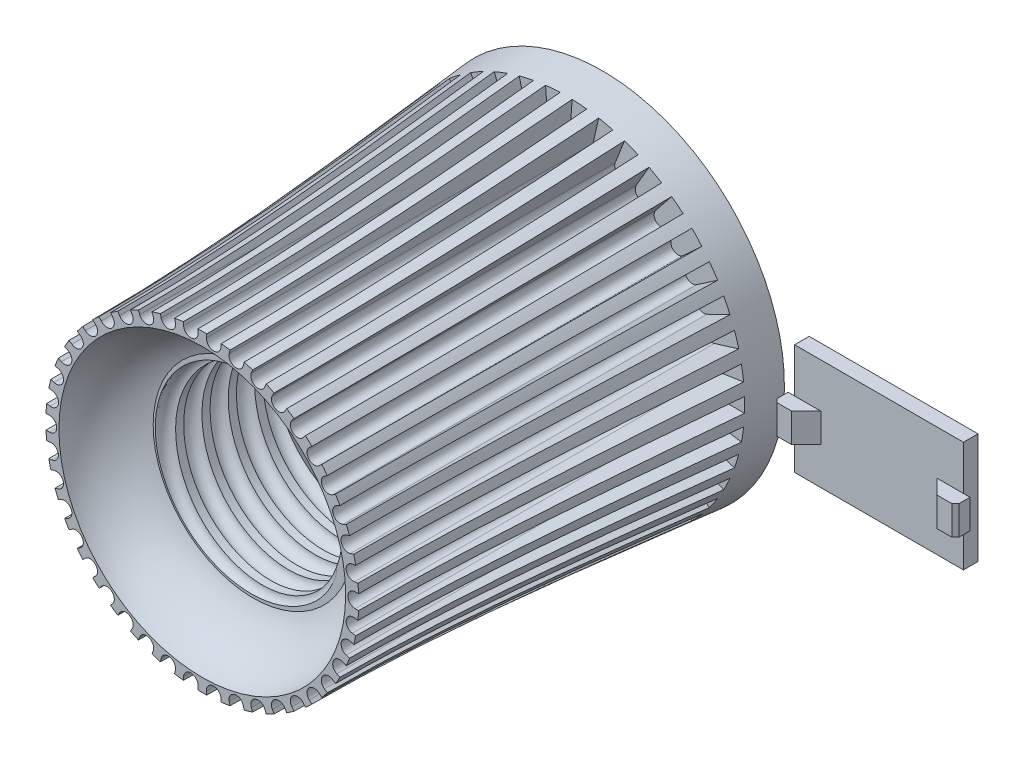
from build123d import *
from build123d.topology import SkipClean

# Parameters (mm, degrees)
CUT_SWEEP1_PITCH         = 3.62
CUT_EXTRUDE1_DEPTH       = 50
SKETCH5_W                = 6
SKETCH5_H                = 12
CUT_EXTRUDE2_DEPTH       = 1
CUT_EXTRUDE3_DEPTH       = 4
SKETCH10_R               = 1.7
CUT_EXTRUDE4_DEPTH       = 10
SKETCH11_W               = 24
SKETCH11_H               = 16
CUT_EXTRUDE5_DEPTH       = 13
SKETCH12_R               = 3
CUT_EXTRUDE6_DEPTH       = 69.840395282
SKETCH13_W               = 2
SKETCH13_H               = 4
CUT_EXTRUDE7_DEPTH       = 1.5
CHAMFER1_SIZE            = 1.5
CHAMFER1_OF_MIRROR1_SIZE = 1.5
SKETCH14_W               = 23.2
SKETCH14_H               = 15.2
EXTRUDE2_DEPTH           = 2
EXTRUDE3_START           = -3.5
EXTRUDE3_DEPTH           = 4
CIRPATTERN1_COUNT        = 42
CUT_EXTRUDE9_START       = -1.5
CUT_EXTRUDE9_DEPTH       = 5
CUT_EXTRUDE10_DEPTH      = 1.5
SKETCH18_W               = 0.9
SKETCH18_H               = 5.399427982
EXTRUDE4_DEPTH           = 7


with BuildPart() as part:
    # Sketch2 → Revolve1 (revolve)
    with BuildSketch(Plane(origin=(0, 0, 0), x_dir=(0, 0, -1), z_dir=(1, 0, 0)), mode=Mode.PRIVATE) as revolve1_sk:
        with BuildLine():
            Line((-48, 12.25), (-33, 12.25))
            Line((-33, 12.25), (-28, 17.25))
            Line((-28, 17.25), (-19, 17.25))
            Line((-19, 17.25), (-19, 3))
            Line((-19, 3), (-18, 3))
            Line((-18, 3), (-18, 1.7))
            Line((-18, 1.7), (-8, 1.7))
            Line((-8, 1.7), (-8, 0))
            Line((-8, 0), (0, 0))
            Line((0, 0), (0, 25))
            add(Edge.make_bspline(
                [(-55, 21.5), (-37.361374455, 21.5), (-18.680687228, 23.25), (0, 25)],
                knots=[0, 0, 0, 0, 1, 1, 1, 1], degree=3))
            Line((-55, 21.5), (-55, 19.7))
            add(Edge.make_bspline(
                [(-55, 19.7), (-51.79205236, 19.20456973), (-48.943366723, 16.663436936), (-48, 13.75)],
                knots=[0, 0, 0, 0, 1, 1, 1, 1], degree=3))
            Line((-48, 13.75), (-48, 12.25))
        make_face()
    revolve(revolve1_sk.sketch.rotate(Axis((0, 0, 0), (0, 0, 1)), 90), axis=Axis((0, 0, 0), (0, 0, 1)))

    # Cut-Sweep1: arcs per turn and ends read off the stored shape
    # Cut-Sweep1: the profile of Sketch7 screwed along a right-hand helix through 6 turns, 6 arcs to a turn; built about Z, then put on its axis
    cut_sweep1_z = Axis((0, 0, 0), (0, 0, 1))
    cut_sweep1_corners = [(12.25, 3.4208e-05, -2.714998391), (2.25, 6.283e-06, -2.714998391), (2.25, 6.283e-06, -0.214998391), (12.25, 3.4208e-05, -0.214998391), (13.5, 3.7699e-05, -1.464998391)]
    with BuildLine(mode=Mode.PRIVATE) as cut_sweep1_profile:
        Line(cut_sweep1_corners[0], cut_sweep1_corners[1])
        Line(cut_sweep1_corners[1], cut_sweep1_corners[2])
        Line(cut_sweep1_corners[2], cut_sweep1_corners[3])
        ThreePointArc((12.25, 3.4208e-05, -0.214998391), (13.133883476, 3.6677e-05, -0.581114915), (13.5, 3.7699e-05, -1.464998391))
        ThreePointArc((13.5, 3.7699e-05, -1.464998391), (13.133883476, 3.6677e-05, -2.348881868), (12.25, 3.4208e-05, -2.714998391))
    cut_sweep1_cap = Face(cut_sweep1_profile.wire())
    cut_sweep1_arcs = [((12.25, 3.4208e-05, -0.214998391), (13.5, 3.7699e-05, -0.214998391), (13.5, 3.7699e-05, -1.464998391), (1, 0.707106781186544, 1)), ((13.5, 3.7699e-05, -1.464998391), (13.5, 3.7699e-05, -2.714998391), (12.25, 3.4208e-05, -2.714998391), (1, 0.707106781186544, 1))]  # start, shoulder, end, weights
    cut_sweep1_turn_angles = [0, 30, 60, 90, 120, 150, 180, 210, 240, 270, 300, 330, 360]
    cut_sweep1_turn_weights = [1, 0.8660254037844387, 1, 0.8660254037844387, 1, 0.8660254037844387, 1, 0.8660254037844387, 1, 0.8660254037844387, 1, 0.8660254037844387, 1]
    cut_sweep1_turn_rails = [Edge.make_bspline([Vector(p[0], p[1], 0).rotate(cut_sweep1_z, cut_sweep1_turn_angles[k]) / cut_sweep1_turn_weights[k] + Vector(0, 0, p[2] + CUT_SWEEP1_PITCH * cut_sweep1_turn_angles[k] / 360) for k in range(13)], [0, 0, 0, 1, 1, 2, 2, 3, 3, 4, 4, 5, 5, 6, 6, 6], 2, cut_sweep1_turn_weights) for p in cut_sweep1_corners]
    cut_sweep1_turn_sides = [*[Face.make_surface_from_curves(cut_sweep1_turn_rails[p[0]], cut_sweep1_turn_rails[p[1]]) for p in [(0, 1), (1, 2), (2, 3)]], *[Face.make_bezier_surface([[Vector(p[j][0], p[j][1], 0).rotate(cut_sweep1_z, cut_sweep1_turn_angles[2 * i + k]) / cut_sweep1_turn_weights[2 * i + k] + Vector(0, 0, p[j][2] + CUT_SWEEP1_PITCH * cut_sweep1_turn_angles[2 * i + k] / 360) for k in range(3)] for j in range(3)], [[p[3][j] * cut_sweep1_turn_weights[2 * i + k] for k in range(3)] for j in range(3)]) for p in cut_sweep1_arcs for i in range(6)]]
    cut_sweep1 = Plane(origin=(0, 0, 48), x_dir=(1, 0, 0), z_dir=(0, 0, -1)) * Solid(Shell([*[p.moved(Location((0, 0, CUT_SWEEP1_PITCH * i))) for i in range(6) for p in cut_sweep1_turn_sides], cut_sweep1_cap, cut_sweep1_cap.rotate(cut_sweep1_z, 2160).moved(Location((0, 0, CUT_SWEEP1_PITCH * 2160 / 360)))]))
    add(cut_sweep1, mode=Mode.SUBTRACT)

    # Sketch3 → Cut-Extrude1 (cut)
    with BuildSketch(Plane.XY.offset(55)):
        with BuildLine():
            Line((21, 1), (25, 1))
            Line((25, 1), (25, -1))
            Line((25, -1), (21, -1))
            ThreePointArc((21, -1), (20, 0), (21, 1))
        make_face()
    cut_extrude1 = extrude(amount=-CUT_EXTRUDE1_DEPTH, mode=Mode.SUBTRACT)

    # Sketch5 → Cut-Extrude2 (cut)
    with BuildSketch(Plane.XY.offset(19)):
        Rectangle(SKETCH5_W, SKETCH5_H)
    extrude(amount=-CUT_EXTRUDE2_DEPTH, mode=Mode.SUBTRACT)

    # Sketch9 → Cut-Extrude3 (cut)
    with BuildSketch(Plane.XY.offset(19)):
        Polygon((-10, 3), (-13, 0), (-10, -3), (-4, -3), (-4, 3), align=None)
    extrude(amount=-CUT_EXTRUDE3_DEPTH, mode=Mode.SUBTRACT)

    # Sketch10 → Cut-Extrude4 (cut)
    with BuildSketch(Plane.XY.offset(15)):
        with Locations((-7, 0)):
            Circle(SKETCH10_R)
    extrude(amount=-CUT_EXTRUDE4_DEPTH, mode=Mode.SUBTRACT)

    # Sketch11 → Cut-Extrude5 (cut)
    with BuildSketch(Plane(origin=(0, 0, 0), x_dir=(-1, 0, 0), z_dir=(0, 0, -1))):
        Rectangle(SKETCH11_W, SKETCH11_H)
    extrude(amount=-CUT_EXTRUDE5_DEPTH, mode=Mode.SUBTRACT)

    # Sketch12 → Cut-Extrude6 (cut, through all)
    with BuildSketch(Plane(origin=(0, -8, 0), x_dir=(1, 0, 0), z_dir=(0, 1, 0))):
        with Locations(Location((0, -4, 0), (0, 0, 270))):
            Circle(SKETCH12_R)
    extrude(amount=-CUT_EXTRUDE6_DEPTH, mode=Mode.SUBTRACT)

    # Sketch13 → Cut-Extrude7 (cut)
    with BuildSketch(Plane(origin=(-12, 0, 0), x_dir=(0, 0, -1), z_dir=(1, 0, 0))):
        with Locations((-3, 0)):
            Rectangle(SKETCH13_W, SKETCH13_H)
    cut_extrude7 = extrude(amount=-CUT_EXTRUDE7_DEPTH, mode=Mode.SUBTRACT)

    # Chamfer1
    chamfer1_edges = [part.edges().sort_by_distance(p)[0] for p in [
        (-13.5, 0, 4),
    ]]
    chamfer(chamfer1_edges, length=CHAMFER1_SIZE - 0.0001)  # a hair under: the kernel refuses the full size

    # Mirror1: Cut-Extrude7 across plane
    add(cut_extrude7.mirror(Plane(origin=(0, 0, 0), x_dir=(0, 0, 1), z_dir=(1, 0, 0))), mode=Mode.SUBTRACT)

    # Chamfer1 of Mirror1
    chamfer1_of_mirror1_edges = [part.edges().sort_by_distance(p)[0] for p in [
        (13.5, 0, 4),
    ]]
    chamfer(chamfer1_of_mirror1_edges, length=CHAMFER1_OF_MIRROR1_SIZE - 0.0001)  # a hair under: the kernel refuses the full size

    # CirPattern1: Cut-Extrude1 ×42 about axis
    cirpattern1_axis = Axis((0, 0, 0), (0, 0, 1))
    for i in range(1, CIRPATTERN1_COUNT):
        add(cut_extrude1.rotate(cirpattern1_axis, i * 360 / CIRPATTERN1_COUNT), mode=Mode.SUBTRACT)

    # Sketch16 → Cut-Extrude9 (cut)
    with BuildSketch(Plane(origin=(0, 0, 0), x_dir=(-1, 0, 0), z_dir=(0, 0, -1)).offset(CUT_EXTRUDE9_START)):
        with BuildLine():
            Line((-3, 16.5), (-3, 12))
            ThreePointArc((-3, 12), (0, 9), (3, 12))
            Line((3, 12), (3, 16.5))
            ThreePointArc((3, 16.5), (0, 19.5), (-3, 16.5))
        make_face()
    extrude(amount=-CUT_EXTRUDE9_DEPTH, mode=Mode.SUBTRACT)

    # Sketch17 → Cut-Extrude10 (cut)
    with SkipClean():  # the faces are left unmerged after this step: merging them gives an invalid solid
        with BuildSketch(Plane(origin=(0, 0, 0), x_dir=(-1, 0, 0), z_dir=(0, 0, -1))):
            with BuildLine():
                Line((-1.5, 14.598076211), (-1.5, 19.098076211))
                ThreePointArc((-1.5, 19.098076211), (0, 19.5), (1.5, 19.098076211))
                Line((1.5, 19.098076211), (1.5, 14.598076211))
                ThreePointArc((1.5, 14.598076211), (2.598076211, 13.5), (3, 12))
                ThreePointArc((3, 12), (0, 9), (-3, 12))
                ThreePointArc((-3, 12), (-2.598076211, 13.5), (-1.5, 14.598076211))
            make_face()
        extrude(amount=-CUT_EXTRUDE10_DEPTH, mode=Mode.SUBTRACT)

    # Sketch18 → Extrude4 (add)
    with SkipClean():  # the faces are left unmerged after this step: merging them gives an invalid solid
        with BuildSketch(Plane(origin=(0, 0, 0), x_dir=(-1, 0, 0), z_dir=(0, 0, -1))):
            with Locations((0, -21.5)):
                Rectangle(SKETCH18_W, SKETCH18_H)
        extrude(amount=-EXTRUDE4_DEPTH)


with BuildPart() as body_2:
    # Sketch14 → Extrude2 (new body)
    with BuildSketch(Plane(origin=(0, 0, 0), x_dir=(-1, 0, 0), z_dir=(0, 0, -1))):
        Rectangle(SKETCH14_W, SKETCH14_H)
    extrude(amount=-EXTRUDE2_DEPTH)


with BuildPart() as body_3:
    # Extrude3: read off the stored shape, not the designer's step
    # Extrude3 outline → Extrude3 (new body)
    with BuildSketch(Plane.XZ.offset(2).offset(EXTRUDE3_START)):
        Polygon((8, 2), (12.5, 2), (12.5, 3.5), (12, 4), (10, 4), align=None)
    extrude(amount=EXTRUDE3_DEPTH)


with BuildPart() as body_4:
    # Mirror4: mirrored copy
    add(body_3.part.mirror(Plane(origin=(0, 0, 0), x_dir=(0, 0, 1), z_dir=(1, 0, 0))))


with BuildPart() as body_2_1:
    add(body_2.part)

    # Combine1: union body 3, body 4
    add(body_3.part)
    add(body_4.part)


with BuildPart() as body_2_2:
    # Body-Move/Copy1: moved
    add(body_2_1.part.moved(Location((40, 0, 0))))


solid = Compound([part.part, body_2_2.part])
